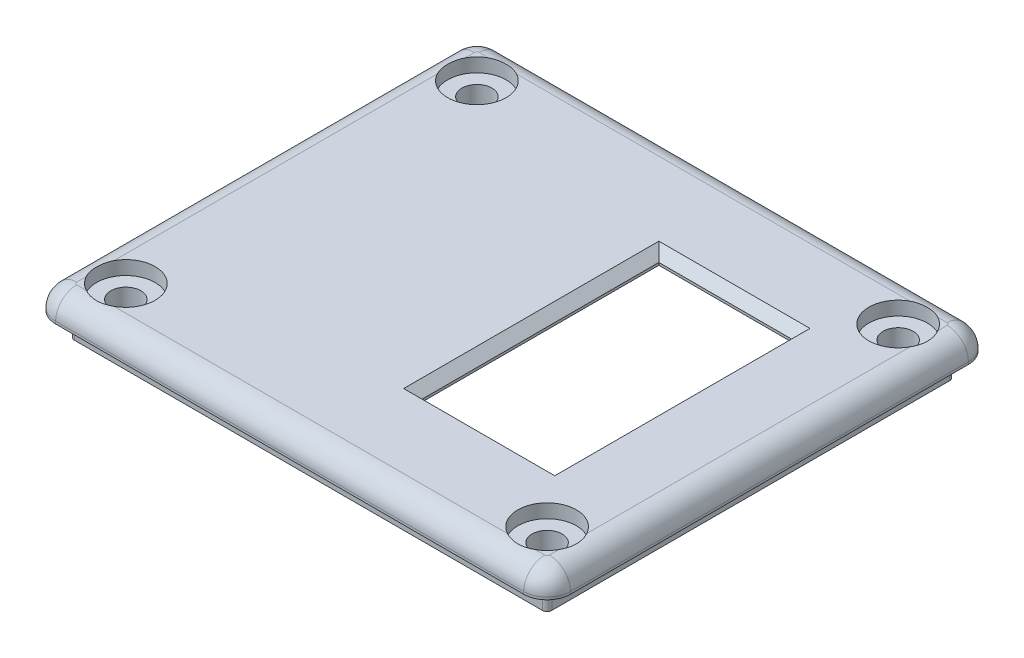
from build123d import *
from build123d.topology import SkipClean

# Parameters (mm, degrees)
BOSS_EXTRUDE1_DEPTH                           = 2.54
BOSS_EXTRUDE2_DEPTH                           = 2.54
FILLET1_R                                     = 2.286
CBORE_FOR_4_BUTTON_HEAD_CAP_SCREW_D           = 3.2639
CBORE_FOR_4_BUTTON_HEAD_CAP_SCREW_CBORE_D     = 6.35
CBORE_FOR_4_BUTTON_HEAD_CAP_SCREW_CBORE_DEPTH = 1.4986
SKETCH6_W                                     = 14.4
SKETCH6_H                                     = 25.7
CUT_EXTRUDE1_DEPTH                            = 244.87875068
SKETCH7_W                                     = 19.48
SKETCH7_H                                     = 30.78
CUT_EXTRUDE2_DEPTH                            = 1.27
CHAMFER1_SIZE                                 = 1
F_4_40_TAPPED_HOLE1_D                         = 2.2606
F_4_40_TAPPED_HOLE1_DEPTH                     = 1.27
F_4_40_TAPPED_HOLE1_TIP                       = 0.679152758
BOSS_EXTRUDE3_START                           = -2
BOSS_EXTRUDE3_OUTLINE_R                       = 1.85
BOSS_EXTRUDE3_OUTLINE_R_2                     = 1.1303
BOSS_EXTRUDE3_DEPTH                           = 3.397
CHAMFER2_SIZE                                 = 1


with BuildPart() as part:
    # Sketch1 → Boss-Extrude1 (new body)
    with BuildSketch(Plane(origin=(0, 0, 0), x_dir=(1, 0, 0), z_dir=(0, 1, 0))):
        with BuildLine():
            Line((24.13, 24.13), (-26.67, 24.13))
            ThreePointArc((-26.67, 24.13), (-28.466051224, 23.386051224), (-29.21, 21.59))
            Line((-29.21, 21.59), (-29.21, -21.59))
            ThreePointArc((-29.21, -21.59), (-28.466051224, -23.386051224), (-26.67, -24.13))
            Line((-26.67, -24.13), (24.13, -24.13))
            ThreePointArc((24.13, -24.13), (25.926051224, -23.386051224), (26.67, -21.59))
            Line((26.67, -21.59), (26.67, 21.59))
            ThreePointArc((26.67, 21.59), (25.926051224, 23.386051224), (24.13, 24.13))
        make_face()
    extrude(amount=BOSS_EXTRUDE1_DEPTH)

    # Sketch3 → Boss-Extrude2 (add)
    with BuildSketch(Plane.XZ):
        with BuildLine():
            Line((24.638, -21.59), (24.638, 21.59))
            ThreePointArc((24.638, 21.59), (24.489210245, 21.949210245), (24.13, 22.098))
            Line((24.13, 22.098), (-26.67, 22.098))
            ThreePointArc((-26.67, 22.098), (-27.029210245, 21.949210245), (-27.178, 21.59))
            Line((-27.178, 21.59), (-27.178, -21.59))
            ThreePointArc((-27.178, -21.59), (-27.029210245, -21.949210245), (-26.67, -22.098))
            Line((-26.67, -22.098), (24.13, -22.098))
            ThreePointArc((24.13, -22.098), (24.489210245, -21.949210245), (24.638, -21.59))
        make_face()
        with BuildLine():
            Line((-20.881289338, -20.193), (18.341289338, -20.193))
            ThreePointArc((18.341289338, -20.193), (19.403923164, -16.863923164), (22.733, -15.801289338))
            Line((22.733, -15.801289338), (22.733, 15.801289338))
            ThreePointArc((22.733, 15.801289338), (19.403923164, 16.863923164), (18.341289338, 20.193))
            Line((18.341289338, 20.193), (-20.881289338, 20.193))
            ThreePointArc((-20.881289338, 20.193), (-21.943923164, 16.863923164), (-25.273, 15.801289338))
            Line((-25.273, 15.801289338), (-25.273, -15.801289338))
            ThreePointArc((-25.273, -15.801289338), (-21.943923164, -16.863923164), (-20.881289338, -20.193))
        make_face(mode=Mode.SUBTRACT)
    extrude(amount=BOSS_EXTRUDE2_DEPTH)

    # Fillet1
    fillet1_edges = [part.edges().sort_by_distance(p)[0] for p in [
        (-28.466051224, 2.54, -23.386051224),
        (-29.21, 2.54, 0),
        (-28.466051224, 2.54, 23.386051224),
        (-1.27, 2.54, 24.13),
        (25.926051224, 2.54, 23.386051224),
        (26.67, 2.54, 0),
        (25.926051224, 2.54, -23.386051224),
        (-1.27, 2.54, -24.13),
    ]]
    fillet(fillet1_edges, radius=FILLET1_R)

    # CBORE for #4 Button Head Cap Screw (through all)
    with Locations(Plane(origin=(107.325337048, 2.54, -177.882723122), x_dir=(1, 0, 0), z_dir=(0, 1, 0))):
        with Locations((-85.735337048, -158.832723122), (-85.735337048, -196.932723122), (-131.455337048, -158.832723122), (-131.455337048, -196.932723122)):
            CounterBoreHole(CBORE_FOR_4_BUTTON_HEAD_CAP_SCREW_D / 2, CBORE_FOR_4_BUTTON_HEAD_CAP_SCREW_CBORE_D / 2, CBORE_FOR_4_BUTTON_HEAD_CAP_SCREW_CBORE_DEPTH)

    # Sketch6 → Cut-Extrude1 (cut, through all)
    with BuildSketch(Plane(origin=(107.325337048, 2.54, -177.882723122), x_dir=(-1, 0, 0), z_dir=(0, 1, 0))):
        with Locations((98.306283227, 177.882723122)):
            Rectangle(SKETCH6_W, SKETCH6_H)
    extrude(amount=-CUT_EXTRUDE1_DEPTH, mode=Mode.SUBTRACT)

    # Sketch7 → Cut-Extrude2 (cut)
    with BuildSketch(Plane.XZ):
        with Locations((9.019053821, 0)):
            Rectangle(SKETCH7_W, SKETCH7_H)
    extrude(amount=-CUT_EXTRUDE2_DEPTH, mode=Mode.SUBTRACT)

    # Chamfer1
    chamfer1_edges = [part.edges().sort_by_distance(p)[0] for p in [
        (16.219053821, 2.54, 0),
        (9.019053821, 2.54, -12.85),
        (1.819053821, 2.54, 0),
        (9.019053821, 2.54, 12.85),
    ]]
    chamfer(chamfer1_edges, length=CHAMFER1_SIZE)

    # #4-40 Tapped Hole1
    with Locations(Plane(origin=(107.325337048, 0, -177.882723122), x_dir=(-1, 0, 0), z_dir=(0, -1, 0))):
        with Locations((88.486283227, -189.532723122), (88.486283227, -166.232723122), (112.286283227, -166.232723122), (112.286283227, -189.532723122)):
            Hole(F_4_40_TAPPED_HOLE1_D / 2, depth=F_4_40_TAPPED_HOLE1_DEPTH)
            with Locations((0, 0, -(F_4_40_TAPPED_HOLE1_DEPTH + F_4_40_TAPPED_HOLE1_TIP / 2))):  # 118° drill point
                Cone(0, F_4_40_TAPPED_HOLE1_D / 2, F_4_40_TAPPED_HOLE1_TIP, mode=Mode.SUBTRACT)

    # Boss-Extrude3: read off the stored shape, not the designer's step
    # Boss-Extrude3 outline → Boss-Extrude3 (add)
    # profile 1 of 4: a face of its own
    with SkipClean():  # the faces are left unmerged after this step: merging them gives an invalid solid
        with BuildSketch(Plane.XZ.offset(BOSS_EXTRUDE3_START)):
            with Locations((18.839053821, 11.65)):
                Circle(BOSS_EXTRUDE3_OUTLINE_R)
            with Locations((18.839053821, 11.65)):
                Circle(BOSS_EXTRUDE3_OUTLINE_R_2, mode=Mode.SUBTRACT)
        # profile 2 of 4: a face of its own
        with BuildSketch(Plane.XZ.offset(BOSS_EXTRUDE3_START)):
            with Locations((18.839053821, -11.65)):
                Circle(BOSS_EXTRUDE3_OUTLINE_R)
            with Locations((18.839053821, -11.65)):
                Circle(BOSS_EXTRUDE3_OUTLINE_R_2, mode=Mode.SUBTRACT)
        # profile 3 of 4: a face of its own
        with BuildSketch(Plane.XZ.offset(BOSS_EXTRUDE3_START)):
            with Locations((-4.960946179, -11.65)):
                Circle(BOSS_EXTRUDE3_OUTLINE_R)
            with Locations((-4.960946179, -11.65)):
                Circle(BOSS_EXTRUDE3_OUTLINE_R_2, mode=Mode.SUBTRACT)
        # profile 4 of 4: a face of its own
        with BuildSketch(Plane.XZ.offset(BOSS_EXTRUDE3_START)):
            with Locations((-4.960946179, 11.65)):
                Circle(BOSS_EXTRUDE3_OUTLINE_R)
            with Locations((-4.960946179, 11.65)):
                Circle(BOSS_EXTRUDE3_OUTLINE_R_2, mode=Mode.SUBTRACT)
        extrude(amount=BOSS_EXTRUDE3_DEPTH)

    # Chamfer2
    chamfer2_edges = [part.edges().sort_by_distance(p)[0] for p in [
        (20.118604523, 0, 10.313867522),
        (20.118604523, 0, -12.986132478),
        (-6.810946179, 0, -11.65),
        (-6.810946179, 0, 11.65),
    ]]
    chamfer(chamfer2_edges, length=CHAMFER2_SIZE)


solid = part.part
